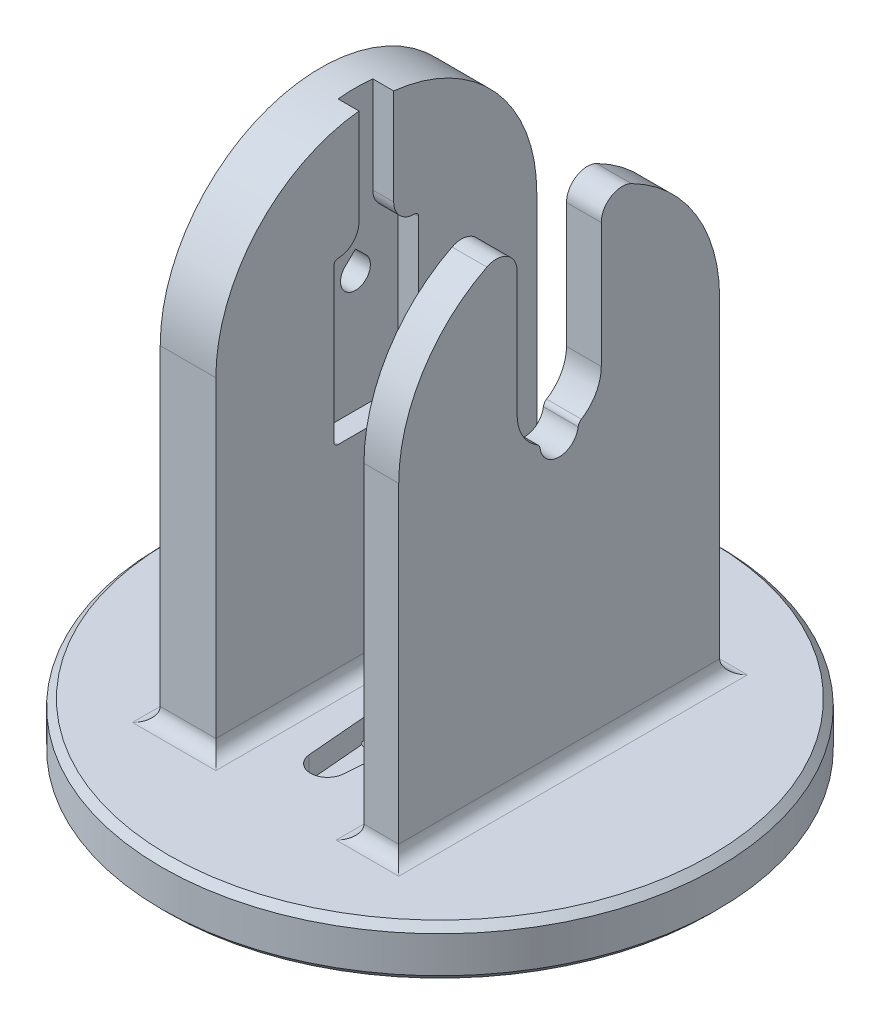
from build123d import *

# Parameters (mm, degrees)
SKETCH4_R                       = 40
BOSS_EXTRUDE2_DEPTH             = 7.23
SKETCH8_W                       = 3
SKETCH8_H                       = 46.15
SKETCH8_W_2                     = 5
BOSS_EXTRUDE3_DEPTH             = 70
FILLET2_RADIUS                  = 23.075
FILLET2_LENGTH                  = 8
FILLET3_RADIUS                  = 23.075
FILLET3_LENGTH                  = 5
FILLET4_R                       = 2
CUT_EXTRUDE3_DEPTH              = 5
FILLET6_R                       = 1
CUT_EXTRUDE4_DEPTH              = 3
F_4_0_START                     = -17.15
F_4_0_MM_DOWEL_HOLES1_OUTLINE_R = 2.15
F_4_0_MM_DOWEL_HOLES1_DEPTH     = 5
CUT_EXTRUDE5_DEPTH              = 37.055
SKETCH19_R                      = 8.7
CUT_EXTRUDE8_DEPTH              = 4.34
CHAMFER1_SIZE                   = 1
CUT_EXTRUDE9_REACH              = 106.07
SKETCH20_W                      = 12.1
SKETCH20_H                      = 23.075
CUT_EXTRUDE10_REACH             = 106.07
CUT_EXTRUDE11_START             = 60.255
SKETCH22_W                      = 3
SKETCH22_H                      = 5
CUT_EXTRUDE11_DEPTH             = 16.975
FILLET9_R                       = 3
FILLET10_R                      = 3
FILLET8_R                       = 3
BOSS_EXTRUDE4_DEPTH             = 4


# Read off the part's stored shape, not the designer's step: Ø4.0 mm Dowel Holes1
with BuildPart() as part:
    # Sketch4 → Boss-Extrude2 (new body)
    with BuildSketch(Plane(origin=(0, 0, 0), x_dir=(1, 0, 0), z_dir=(0, 1, 0))):
        with Locations(Location((0, 0, 0), (0, 0, 270))):
            Circle(SKETCH4_R)
    extrude(amount=BOSS_EXTRUDE2_DEPTH)

    # Sketch8 → Boss-Extrude3 (add)
    with BuildSketch(Plane(origin=(0, 7.23, 0), x_dir=(1, 0, 0), z_dir=(0, 1, 0))):
        with Locations((-10.65, 0)):
            Rectangle(SKETCH8_W, SKETCH8_H)
        with Locations((-14.65, 0)):
            Rectangle(SKETCH8_W_2, SKETCH8_H)
        with Locations((14.65, 0)):
            Rectangle(SKETCH8_W_2, SKETCH8_H)
    extrude(amount=BOSS_EXTRUDE3_DEPTH)

    # Fillet2: full round fillet: the end face becomes a half cylinder, R = half its width
    fillet2_face = Plane((-13.15, 77.23, 0), x_dir=(-1, 0, 0), z_dir=(0, 1, 0))  # on the end face: x along it, z out of the body
    fillet2_slab = fillet2_face.offset(-FILLET2_RADIUS / 2) * Box(FILLET2_LENGTH, 2 * FILLET2_RADIUS, FILLET2_RADIUS, mode=Mode.PRIVATE)  # the body's end, R deep
    fillet2_round = Plane((-13.15, 54.155, 0), x_dir=(0, 1, 0), z_dir=(-1, 0, 0)) * Cylinder(FILLET2_RADIUS, FILLET2_LENGTH, mode=Mode.PRIVATE)  # its axis R under the face
    add(fillet2_slab - fillet2_round, mode=Mode.SUBTRACT)

    # Fillet3: full round fillet: the end face becomes a half cylinder, R = half its width
    fillet3_face = Plane((14.65, 77.23, 0), x_dir=(1, 0, 0), z_dir=(0, 1, 0))  # on the end face: x along it, z out of the body
    fillet3_slab = fillet3_face.offset(-FILLET3_RADIUS / 2) * Box(FILLET3_LENGTH, 2 * FILLET3_RADIUS, FILLET3_RADIUS, mode=Mode.PRIVATE)  # the body's end, R deep
    fillet3_round = Plane((14.65, 54.155, 0), x_dir=(0, 1, 0), z_dir=(1, 0, 0)) * Cylinder(FILLET3_RADIUS, FILLET3_LENGTH, mode=Mode.PRIVATE)  # its axis R under the face
    add(fillet3_slab - fillet3_round, mode=Mode.SUBTRACT)

    # Fillet4
    fillet4_edges = [part.edges().sort_by_distance(p)[0] for p in [
        (-9.15, 7.23, 0),
        (-17.15, 7.23, 0),
        (-13.15, 7.23, -23.075),
        (17.15, 7.23, 0),
        (14.65, 7.23, -23.075),
        (12.15, 7.23, 0),
        (14.65, 7.23, 23.075),
        (-13.15, 7.23, 23.075),
    ]]
    fillet(fillet4_edges, radius=FILLET4_R)

    # Sketch10 → Cut-Extrude3 (cut)
    with BuildSketch(Plane(origin=(17.15, 0, 0), x_dir=(0, 0, -1), z_dir=(1, 0, 0))):
        with BuildLine():
            ThreePointArc((-2.747799119, 48.765), (-1.983053202, 46.749744112), (0, 45.905))
            Line((0, 45.905), (0, 48.105))
            ThreePointArc((0, 48.105), (-1.412975584, 48.272313539), (-2.747799119, 48.765))
        make_face()
        with BuildLine():
            Line((0, 48.105), (0, 45.905))
            ThreePointArc((0, 45.905), (1.944543648, 46.710456352), (2.75, 48.655))
            ThreePointArc((2.75, 48.655), (2.749449725, 48.710011008), (2.747799119, 48.765))
            ThreePointArc((2.747799119, 48.765), (1.412975584, 48.272313539), (0, 48.105))
        make_face()
        with BuildLine():
            ThreePointArc((-2.747799119, 48.765), (-1.412975584, 48.272313539), (0, 48.105))
            Line((0, 48.105), (0, 51.405))
            ThreePointArc((0, 51.405), (-1.905255888, 50.638053202), (-2.747799119, 48.765))
        make_face()
        with BuildLine():
            Line((0, 51.405), (0, 48.105))
            ThreePointArc((0, 48.105), (1.412975584, 48.272313539), (2.747799119, 48.765))
            ThreePointArc((2.747799119, 48.765), (1.905255888, 50.638053202), (0, 51.405))
        make_face()
        with BuildLine():
            ThreePointArc((0, 60.205), (-5.882686461, 55.567975584), (-2.747799119, 48.765))
            ThreePointArc((-2.747799119, 48.765), (-1.905255888, 50.638053202), (0, 51.405))
            Line((0, 51.405), (0, 60.205))
        make_face()
        with BuildLine():
            Line((0, 60.205), (0, 51.405))
            ThreePointArc((0, 51.405), (1.905255888, 50.638053202), (2.747799119, 48.765))
            ThreePointArc((2.747799119, 48.765), (5.158812105, 50.994437129), (6.05, 54.155))
            ThreePointArc((6.05, 54.155), (4.277996026, 58.432996026), (0, 60.205))
        make_face()
    extrude(amount=-CUT_EXTRUDE3_DEPTH, mode=Mode.SUBTRACT)

    # Fillet6
    fillet6_edges = [part.edges().sort_by_distance(p)[0] for p in [
        (14.65, 48.765, -2.747799119),
        (14.65, 48.765, 2.747799119),
    ]]
    fillet(fillet6_edges, radius=FILLET6_R)

    # Sketch11 → Cut-Extrude4 (cut)
    # profile 1 of 2: a face of its own
    with BuildSketch(Plane(origin=(-9.15, 0, 0), x_dir=(0, 0, -1), z_dir=(1, 0, 0))):
        with BuildLine():
            Line((6.1, 54.155), (6.1, 59.655))
            ThreePointArc((6.1, 59.655), (5.924264069, 60.079264069), (5.5, 60.255))
            Line((5.5, 60.255), (0, 60.255))
            Line((0, 60.255), (-5.5, 60.255))
            ThreePointArc((-5.5, 60.255), (-5.924264069, 60.079264069), (-6.1, 59.655))
            Line((-6.1, 59.655), (-6.1, 54.155))
            Line((-6.1, 54.155), (-6.1, 37.655))
            ThreePointArc((-6.1, 37.655), (-5.924264069, 37.230735931), (-5.5, 37.055))
            Line((-5.5, 37.055), (5.5, 37.055))
            ThreePointArc((5.5, 37.055), (5.924264069, 37.230735931), (6.1, 37.655))
            Line((6.1, 37.655), (6.1, 54.155))
        make_face()
        with BuildLine():
            ThreePointArc((-5.5, 60.155), (-5.853553391, 60.008553391), (-6, 59.655))
            Line((-6, 59.655), (-6, 54.155))
            Line((-6, 54.155), (-6, 37.655))
            ThreePointArc((-6, 37.655), (-5.853553391, 37.301446609), (-5.5, 37.155))
            Line((-5.5, 37.155), (5.5, 37.155))
            ThreePointArc((5.5, 37.155), (5.853553391, 37.301446609), (6, 37.655))
            Line((6, 37.655), (6, 54.155))
            Line((6, 54.155), (6, 59.655))
            ThreePointArc((6, 59.655), (5.853553391, 60.008553391), (5.5, 60.155))
            Line((5.5, 60.155), (0, 60.155))
            Line((0, 60.155), (-5.5, 60.155))
        make_face(mode=Mode.SUBTRACT)
    # profile 2 of 2: a face of its own
    with BuildSketch(Plane(origin=(-9.15, 0, 0), x_dir=(0, 0, -1), z_dir=(1, 0, 0))):
        with BuildLine():
            Line((0, 60.155), (-5.5, 60.155))
            ThreePointArc((-5.5, 60.155), (-5.853553391, 60.008553391), (-6, 59.655))
            Line((-6, 59.655), (-6, 54.155))
            Line((-6, 54.155), (-6, 37.655))
            ThreePointArc((-6, 37.655), (-5.853553391, 37.301446609), (-5.5, 37.155))
            Line((-5.5, 37.155), (5.5, 37.155))
            ThreePointArc((5.5, 37.155), (5.853553391, 37.301446609), (6, 37.655))
            Line((6, 37.655), (6, 54.155))
            Line((6, 54.155), (6, 59.655))
            ThreePointArc((6, 59.655), (5.853553391, 60.008553391), (5.5, 60.155))
            Line((5.5, 60.155), (0, 60.155))
        make_face()
    extrude(amount=-CUT_EXTRUDE4_DEPTH, mode=Mode.SUBTRACT)

    # Ø4.0 mm Dowel Holes1 outline → Ø4.0 mm Dowel Holes1 (cut)
    with BuildSketch(Plane.YZ.offset(F_4_0_START)):
        with Locations((54.155, 0)):
            Circle(F_4_0_MM_DOWEL_HOLES1_OUTLINE_R)
    extrude(amount=F_4_0_MM_DOWEL_HOLES1_DEPTH, mode=Mode.SUBTRACT)

    # Sketch17 → Cut-Extrude5 (cut)
    with BuildSketch(Plane.XZ):
        with BuildLine():
            ThreePointArc((-2.429157046, -16.365855829), (0, -18.6), (2.429157046, -16.365855829))
            Line((2.429157046, -16.365855829), (3.747720192, -0.628166667))
            ThreePointArc((3.747720192, -0.628166667), (3.8, 0), (3.747720192, 0.628166667))
            Line((3.747720192, 0.628166667), (2.429157046, 16.365855829))
            ThreePointArc((2.429157046, 16.365855829), (0, 18.6), (-2.429157046, 16.365855829))
            Line((-2.429157046, 16.365855829), (-3.747720192, 0.628166667))
            ThreePointArc((-3.747720192, 0.628166667), (-3.8, 0), (-3.747720192, -0.628166667))
            Line((-3.747720192, -0.628166667), (-2.429157046, -16.365855829))
        make_face()
    extrude(amount=-CUT_EXTRUDE5_DEPTH, mode=Mode.SUBTRACT)

    # Sketch19 → Cut-Extrude8 (cut)
    with BuildSketch(Plane.XZ):
        Circle(SKETCH19_R)
    extrude(amount=-CUT_EXTRUDE8_DEPTH, mode=Mode.SUBTRACT)

    # Chamfer1
    chamfer1_edges = [part.edges().sort_by_distance(p)[0] for p in [
        (0, 0, -40),
        (0, 7.23, -40),
    ]]
    chamfer(chamfer1_edges, length=CHAMFER1_SIZE)

    # Sketch20 → Cut-Extrude9 (cut, up to next)
    with BuildSketch(Plane(origin=(17.15, 0, 0), x_dir=(0, 0, -1), z_dir=(1, 0, 0)), mode=Mode.PRIVATE) as cut_extrude9_sk1:
        with Locations((0, 65.6925)):
            Rectangle(SKETCH20_W, SKETCH20_H)
    cut_extrude9_tool1 = extrude(cut_extrude9_sk1.sketch, amount=-CUT_EXTRUDE9_REACH, mode=Mode.PRIVATE) & part.part
    add(cut_extrude9_tool1.solids().sort_by_distance((17.15, 65.6925, 0))[0], mode=Mode.SUBTRACT)

    # Sketch21 → Cut-Extrude10 (cut, up to next)
    with BuildSketch(Plane.ZY.offset(17.15), mode=Mode.PRIVATE) as cut_extrude10_sk1:
        Polygon((-1.49944411, 55.695833333), (0, 57.155), (1.49944411, 55.695833333), align=None)
    cut_extrude10_tool1 = extrude(cut_extrude10_sk1.sketch, amount=-CUT_EXTRUDE10_REACH, mode=Mode.PRIVATE) & part.part
    add(cut_extrude10_tool1.solids().sort_by_distance((-17.15, 56.182222, 0))[0], mode=Mode.SUBTRACT)

    # Sketch22 → Cut-Extrude11 (cut)
    with BuildSketch(Plane(origin=(0, 0, 0), x_dir=(1, 0, 0), z_dir=(0, 1, 0)).offset(CUT_EXTRUDE11_START)):
        with Locations((-10.65, 0)):
            Rectangle(SKETCH22_W, SKETCH22_H)
    extrude(amount=CUT_EXTRUDE11_DEPTH, mode=Mode.SUBTRACT)

    # Fillet9
    fillet9_edges = [part.edges().sort_by_distance(p)[0] for p in [
        (-10.65, 60.255, 2.5),
    ]]
    fillet(fillet9_edges, radius=FILLET9_R - 0.0001)  # a hair under: the kernel refuses the full size

    # Fillet10
    fillet10_edges = [part.edges().sort_by_distance(p)[0] for p in [
        (-10.65, 60.255, -2.5),
    ]]
    fillet(fillet10_edges, radius=FILLET10_R - 0.0001)  # a hair under: the kernel refuses the full size

    # Fillet8
    fillet8_edges = [part.edges().sort_by_distance(p)[0] for p in [
        (14.65, 76.422759766, -6.05),
        (14.65, 76.422759766, 6.05),
    ]]
    fillet(fillet8_edges, radius=FILLET8_R)

    # Sketch23 → Boss-Extrude4 (add)
    with BuildSketch(Plane.XZ):
        with BuildLine():
            ThreePointArc((-2.429157046, -16.365855829), (0, -18.6), (2.429157046, -16.365855829))
            Line((2.429157046, -16.365855829), (3.119913913, -8.121338386))
            ThreePointArc((3.119913913, -8.121338386), (0, -8.7), (-3.119913913, -8.121338386))
            Line((-3.119913913, -8.121338386), (-2.429157046, -16.365855829))
        make_face()
        with BuildLine():
            Line((-2.429157046, 16.365855829), (-3.119913913, 8.121338386))
            ThreePointArc((-3.119913913, 8.121338386), (0, 8.7), (3.119913913, 8.121338386))
            Line((3.119913913, 8.121338386), (2.429157046, 16.365855829))
            ThreePointArc((2.429157046, 16.365855829), (0, 18.6), (-2.429157046, 16.365855829))
        make_face()
    extrude(amount=-BOSS_EXTRUDE4_DEPTH)


solid = part.part
